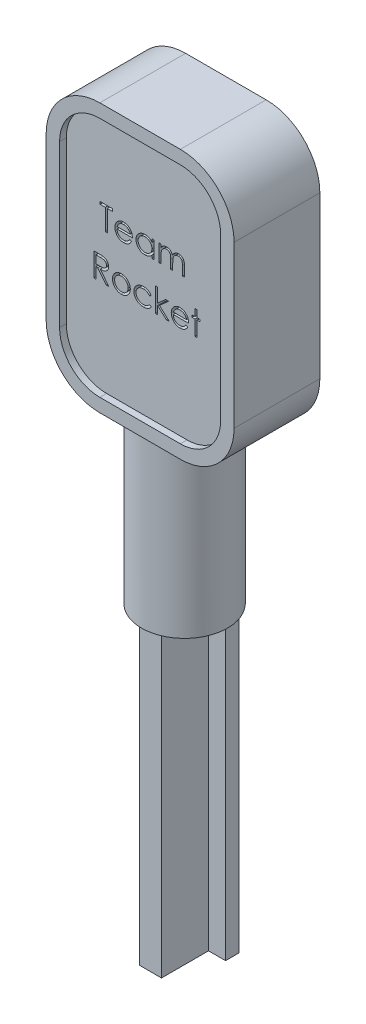
from build123d import *

# Parameters (mm, degrees)
SKETCH7_W           = 8.336373434
SKETCH7_H           = 1.970724418
SKETCH7_W_2         = 3.256066215
SKETCH7_H_2         = 7.004216531
BOSS_EXTRUDE4_DEPTH = 45
SKETCH13_R          = 6.4
BOSS_EXTRUDE7_DEPTH = 25
SKETCH10_W          = 28
SKETCH10_H          = 12.782122078
SKETCH10_R          = 0.037506011
BOSS_EXTRUDE6_DEPTH = 40
FILLET3_R           = 8
FILLET4_R           = 8
FILLET5_R           = 8
FILLET6_R           = 8
CUT_EXTRUDE1_DEPTH  = 1
CUT_EXTRUDE2_START  = -1
CUT_EXTRUDE2_DEPTH  = 1
CUT_EXTRUDE3_DEPTH  = 2


with BuildPart() as part:
    # Sketch7 → Boss-Extrude4 (new body)
    with BuildSketch(Plane(origin=(0, 0, 0), x_dir=(1, 0, 0), z_dir=(0, 1, 0))):
        with Locations((-1.960459031, 3.602750247)):
            Rectangle(SKETCH7_W, SKETCH7_H)
        with Locations((-1.960459031, -0.884720228)):
            Rectangle(SKETCH7_W_2, SKETCH7_H_2)
    extrude(amount=BOSS_EXTRUDE4_DEPTH)

    # Sketch13 → Boss-Extrude7 (add)
    with BuildSketch(Plane(origin=(0, 45, 0), x_dir=(1, 0, 0), z_dir=(0, 1, 0))):
        with Locations(Location((-1.960459031, 0.672633255, 0), (0, 0, 270))):
            Circle(SKETCH13_R)
    extrude(amount=BOSS_EXTRUDE7_DEPTH)

    # Sketch10 → Boss-Extrude6 (add)
    with BuildSketch(Plane(origin=(0, 70, 0), x_dir=(1, 0, 0), z_dir=(0, 1, 0))):
        with Locations((-1.858685537, 0.341682691)):
            Rectangle(SKETCH10_W, SKETCH10_H)
        with Locations(Location((3.255474538, 4.236787445, 0), (0, 0, 270))):
            Circle(SKETCH10_R, mode=Mode.SUBTRACT)
    extrude(amount=BOSS_EXTRUDE6_DEPTH)

    # Fillet3
    # the kernel refuses this fillet: 8 mm, written as the material it takes off along each edge
    with BuildSketch(Plane(origin=(12.141314463, 70, -26.73274373), x_dir=(-1, 0, 0), z_dir=(0, 0, 1))) as fillet3_piece_1_section:
        with BuildLine():
            CenterArc((FILLET3_R, -FILLET3_R), FILLET3_R, 90, 90)
            Line((0, -FILLET3_R), (0, 0))
            Line((0, 0), (FILLET3_R, 0))
        make_face()
    fillet3_piece_1 = extrude(amount=52.782122079, mode=Mode.PRIVATE)
    fillet3_piece_1 = fillet3_piece_1 - Plane(origin=(-1.960459031, 71.811434003, -0.672633255), x_dir=(0, 0, 1), z_dir=(0, -1, 0)) * Cylinder(6.4, 138, mode=Mode.PRIVATE)
    add(fillet3_piece_1, mode=Mode.SUBTRACT)

    # Fillet4
    # the kernel refuses this fillet: 8 mm, written as the material it takes off along each edge
    with BuildSketch(Plane(origin=(-15.858685537, 70, 26.049378348), x_dir=(1, 0, 0), z_dir=(0, 0, -1))) as fillet4_piece_1_section:
        with BuildLine():
            CenterArc((FILLET4_R, -FILLET4_R), FILLET4_R, 90, 90)
            Line((0, -FILLET4_R), (0, 0))
            Line((0, 0), (FILLET4_R, 0))
        make_face()
    fillet4_piece_1 = extrude(amount=52.782122079, mode=Mode.PRIVATE)
    fillet4_piece_1 = fillet4_piece_1 - Plane(origin=(-1.960459031, 71.811762355, -0.672633255), x_dir=(0, 0, 1), z_dir=(0, -1, 0)) * Cylinder(6.4, 138, mode=Mode.PRIVATE)
    add(fillet4_piece_1, mode=Mode.SUBTRACT)

    # Fillet5
    fillet5_edges = [part.edges().sort_by_distance(p)[0] for p in [
        (12.141314463, 110, -0.341682691),
    ]]
    fillet(fillet5_edges, radius=FILLET5_R)

    # Fillet6
    fillet6_edges = [part.edges().sort_by_distance(p)[0] for p in [
        (-15.858685537, 110, -0.341682691),
    ]]
    fillet(fillet6_edges, radius=FILLET6_R)

    # Sketch11 → Cut-Extrude1 (cut)
    with BuildSketch(Plane(origin=(0, 0, -6.73274373), x_dir=(-1, 0, 0), z_dir=(0, 0, -1))):
        with BuildLine():
            Line((4.018385421, 72), (7.858685537, 72))
            ThreePointArc((7.858685537, 72), (12.101326224, 73.757359313), (13.858685537, 78))
            Line((13.858685537, 78), (13.858685537, 102))
            ThreePointArc((13.858685537, 102), (12.101326224, 106.242640687), (7.858685537, 108))
            Line((7.858685537, 108), (-4.141314463, 108))
            ThreePointArc((-4.141314463, 108), (-8.38395515, 106.242640687), (-10.141314463, 102))
            Line((-10.141314463, 102), (-10.141314463, 78))
            ThreePointArc((-10.141314463, 78), (-8.38395515, 73.757359313), (-4.141314463, 72))
            Line((-4.141314463, 72), (-0.09746736, 72))
            Line((-0.09746736, 72), (4.018385421, 72))
        make_face()
    extrude(amount=-CUT_EXTRUDE1_DEPTH, mode=Mode.SUBTRACT)

    # Sketch12 → Cut-Extrude2 (cut)
    with BuildSketch(Plane.XY.offset(6.049378348).offset(CUT_EXTRUDE2_START)):
        with BuildLine():
            Line((4.141314463, 108), (-7.858685537, 108))
            ThreePointArc((-7.858685537, 108), (-12.101326224, 106.242640687), (-13.858685537, 102))
            Line((-13.858685537, 102), (-13.858685537, 78))
            ThreePointArc((-13.858685537, 78), (-12.101326224, 73.757359313), (-7.858685537, 72))
            Line((-7.858685537, 72), (4.141314463, 72))
            ThreePointArc((4.141314463, 72), (8.38395515, 73.757359313), (10.141314463, 78))
            Line((10.141314463, 78), (10.141314463, 102))
            ThreePointArc((10.141314463, 102), (8.38395515, 106.242640687), (4.141314463, 108))
        make_face()
    extrude(amount=CUT_EXTRUDE2_DEPTH, mode=Mode.SUBTRACT)

    # Sketch14 → Cut-Extrude3 (cut)
    # profile 1 of 10: a face of its own
    with BuildSketch(Plane.XY.offset(5.049378348)):
        Polygon((-8.80905258, 95.927677852), (-8.80905258, 96.286652211), (-6.96930899, 96.286652211), (-6.96930899, 95.927677852), (-7.732129503, 95.927677852), (-7.732129503, 92.786652211), (-8.046232067, 92.786652211), (-8.046232067, 95.927677852), align=None)
    # profile 2 of 10: a face of its own
    with BuildSketch(Plane.XY.offset(5.049378348)):
        with BuildLine():
            Line((-4.421432387, 93.594344519), (-4.142385913, 93.447810063))
            add(Edge.make_bspline(
                [(-4.142385913, 93.447810063), (-4.164622508, 93.408366732), (-4.207886117, 93.331625629), (-4.282286864, 93.226193769), (-4.360278937, 93.131346053), (-4.445382905, 93.049616399), (-4.535052584, 92.978365014), (-4.629785239, 92.916027189), (-4.730074057, 92.862908669), (-4.835923781, 92.818156141), (-4.948223332, 92.783746647), (-5.067244849, 92.759442426), (-5.193216344, 92.744419157), (-5.279562524, 92.742674016), (-5.323776137, 92.741780416)],
                knots=[0, 0, 0, 0, 1.120438281, 2.179929193, 3.190490725, 4.156257408, 5.095198341, 6.022838206, 6.959905092, 7.901321166, 8.864066838, 9.862729781, 10.905609505, 12, 12, 12, 12], degree=3))
            add(Edge.make_bspline(
                [(-5.323776137, 92.741780416), (-5.372918115, 92.742927591), (-5.468779876, 92.745165398), (-5.608319624, 92.764457862), (-5.739699042, 92.795930221), (-5.862910745, 92.839895763), (-5.977652998, 92.897323087), (-6.084153853, 92.967282569), (-6.182973379, 93.049414823), (-6.270997588, 93.144431267), (-6.35024147, 93.246113224), (-6.42016729, 93.352069109), (-6.478624721, 93.462032333), (-6.526177332, 93.575302857), (-6.564582197, 93.691166751), (-6.5913489, 93.810678218), (-6.606778648, 93.933513802), (-6.609143094, 94.016611138), (-6.610334631, 94.058487147)],
                knots=[0, 0, 0, 0, 1.145258523, 2.234067595, 3.276747158, 4.290159414, 5.277019952, 6.260822364, 7.254936242, 8.264827045, 9.274100331, 10.257902744, 11.220704747, 12.172965371, 13.118907548, 14.062713208, 15.023725156, 16, 16, 16, 16], degree=3))
            add(Edge.make_bspline(
                [(-6.610334631, 94.058487147), (-6.609275489, 94.097781977), (-6.607176411, 94.175659142), (-6.593945624, 94.290924686), (-6.570497331, 94.402953139), (-6.538321007, 94.511837587), (-6.496769761, 94.617395721), (-6.445937541, 94.719691785), (-6.385745164, 94.818616924), (-6.33927249, 94.881020058), (-6.315863477, 94.912453493)],
                knots=[0, 0, 0, 0, 1.024358464, 2.0301432, 3.019427413, 4.004406732, 4.986367066, 5.972626655, 6.978780325, 8, 8, 8, 8], degree=3))
            add(Edge.make_bspline(
                [(-6.315863477, 94.912453493), (-6.284155794, 94.950322363), (-6.221744848, 95.024860513), (-6.116188492, 95.122798839), (-6.001888296, 95.204842614), (-5.88027667, 95.272849751), (-5.749940196, 95.324523398), (-5.612630905, 95.36303098), (-5.466785318, 95.384608991), (-5.367080098, 95.387656824), (-5.316063797, 95.389216313)],
                knots=[0, 0, 0, 0, 1.030682036, 2.02871468, 2.997146059, 3.962720338, 4.930598197, 5.918074684, 6.934738563, 8, 8, 8, 8], degree=3))
            add(Edge.make_bspline(
                [(-5.316063797, 95.389216313), (-5.263616192, 95.387862265), (-5.160725946, 95.385205929), (-5.010693825, 95.360579596), (-4.868733109, 95.321527041), (-4.734900604, 95.266373251), (-4.609182744, 95.195213699), (-4.492396694, 95.107071858), (-4.382545181, 95.00465377), (-4.318636603, 94.925890561), (-4.286115881, 94.885810865)],
                knots=[0, 0, 0, 0, 1.056321875, 2.072262726, 3.055038591, 4.01806755, 4.982017516, 5.957941055, 6.960871419, 8, 8, 8, 8], degree=3))
            add(Edge.make_bspline(
                [(-4.286115881, 94.885810865), (-4.263988943, 94.855607283), (-4.219882349, 94.795401165), (-4.164635249, 94.697230008), (-4.116677854, 94.594519413), (-4.078344893, 94.485609116), (-4.047305392, 94.371789536), (-4.024848573, 94.252246991), (-4.011678955, 94.12701708), (-4.009090258, 94.041690524), (-4.007770528, 93.998190672)],
                knots=[0, 0, 0, 0, 0.94817472, 1.890038105, 2.849395472, 3.817997239, 4.812318967, 5.836947057, 6.897266129, 8, 8, 8, 8], degree=3))
            Line((-4.007770528, 93.998190672), (-6.296232067, 93.998190672))
            add(Edge.make_bspline(
                [(-6.296232067, 93.998190672), (-6.29469246, 93.964490208), (-6.291664886, 93.898219604), (-6.277549743, 93.801248821), (-6.255300969, 93.708875479), (-6.224031907, 93.621792437), (-6.186165062, 93.53886231), (-6.139779345, 93.460700273), (-6.084439791, 93.387662343), (-6.022714091, 93.319095205), (-5.954006996, 93.258034444), (-5.881724249, 93.203382668), (-5.804830684, 93.157577071), (-5.7239326, 93.120397181), (-5.639160815, 93.091290865), (-5.55048862, 93.071423044), (-5.458090504, 93.058115938), (-5.39510477, 93.056636272), (-5.363038958, 93.05588298)],
                knots=[0, 0, 0, 0, 1.094153842, 2.151609401, 3.174256925, 4.172055639, 5.149267565, 6.128595816, 7.11444997, 8.118368179, 9.117203808, 10.09244225, 11.054858984, 12.015122123, 12.976791628, 13.957293641, 14.960065497, 16, 16, 16, 16], degree=3))
            add(Edge.make_bspline(
                [(-5.363038958, 93.05588298), (-5.33168781, 93.056491037), (-5.269481119, 93.057697538), (-5.176840262, 93.069429449), (-5.085700734, 93.088399724), (-4.996439751, 93.114289714), (-4.910868905, 93.145866567), (-4.831623355, 93.183969424), (-4.75874314, 93.226119171), (-4.690626173, 93.274328846), (-4.62455518, 93.333337033), (-4.559012693, 93.406972754), (-4.48873604, 93.494060282), (-4.444746447, 93.559605948), (-4.421432387, 93.594344519)],
                knots=[0, 0, 0, 0, 0.99110716, 1.966546729, 2.947904876, 3.932708344, 4.903319531, 5.828989031, 6.710028674, 7.56322171, 8.463672341, 9.504779593, 10.677557249, 12, 12, 12, 12], degree=3))
        make_face()
        with BuildLine():
            add(Edge.make_bspline(
                [(-4.321873092, 94.312293237), (-4.333369717, 94.35395611), (-4.355497018, 94.434143731), (-4.401733383, 94.545184621), (-4.453804924, 94.643872522), (-4.515426655, 94.729452155), (-4.585245381, 94.805455668), (-4.665890563, 94.871874253), (-4.756326457, 94.931291705), (-4.856085597, 94.981444204), (-4.961727382, 95.024134063), (-5.072333574, 95.052759178), (-5.185191362, 95.072368721), (-5.261525649, 95.074194829), (-5.299937996, 95.075113749)],
                knots=[0, 0, 0, 0, 1.154881502, 2.222775134, 3.210006277, 4.132804581, 5.035138423, 5.962687519, 6.919655026, 7.923214229, 8.944639381, 9.960483929, 10.97369054, 12, 12, 12, 12], degree=3))
            add(Edge.make_bspline(
                [(-5.299937996, 95.075113749), (-5.331287435, 95.074502078), (-5.393258684, 95.073292932), (-5.484559752, 95.061822802), (-5.572239451, 95.042862958), (-5.656944738, 95.016898001), (-5.737565607, 94.982289398), (-5.815760375, 94.941706172), (-5.889540771, 94.892164588), (-5.935682067, 94.854405733), (-5.958992483, 94.835330095)],
                knots=[0, 0, 0, 0, 1.04873581, 2.073130211, 3.073294108, 4.04793562, 5.032784715, 6.005352987, 6.992311501, 8, 8, 8, 8], degree=3))
            add(Edge.make_bspline(
                [(-5.958992483, 94.835330095), (-5.975685765, 94.82023578), (-6.0094689, 94.789688564), (-6.054609421, 94.737059357), (-6.097829894, 94.680307795), (-6.137163547, 94.617262671), (-6.173241133, 94.548641891), (-6.20700111, 94.475024256), (-6.237387522, 94.395851126), (-6.254483632, 94.340678687), (-6.263279342, 94.312293237)],
                knots=[0, 0, 0, 0, 0.879870761, 1.780643979, 2.707998968, 3.669668524, 4.684282772, 5.740141944, 6.837334558, 8, 8, 8, 8], degree=3))
            Line((-6.263279342, 94.312293237), (-4.321873092, 94.312293237))
        make_face(mode=Mode.SUBTRACT)
    # profile 3 of 10: a face of its own
    with BuildSketch(Plane.XY.offset(5.049378348)):
        with BuildLine():
            Line((-0.777001297, 95.344344519), (-0.777001297, 92.786652211))
            Line((-0.777001297, 92.786652211), (-1.091103862, 92.786652211))
            Line((-1.091103862, 92.786652211), (-1.091103862, 93.229060063))
            add(Edge.make_bspline(
                [(-1.091103862, 93.229060063), (-1.126522652, 93.189020469), (-1.195642867, 93.110882698), (-1.311083985, 93.008800526), (-1.433452163, 92.924422204), (-1.562153485, 92.856272289), (-1.697071728, 92.805080232), (-1.837907815, 92.768694073), (-1.984719196, 92.745300238), (-2.084971551, 92.742964216), (-2.135775336, 92.741780416)],
                knots=[0, 0, 0, 0, 1.074387032, 2.096679803, 3.090159297, 4.057316773, 5.018401886, 5.985159533, 6.978961417, 8, 8, 8, 8], degree=3))
            add(Edge.make_bspline(
                [(-2.135775336, 92.741780416), (-2.18094329, 92.743006788), (-2.270016495, 92.745425249), (-2.401045572, 92.764187552), (-2.527137821, 92.794318174), (-2.648412394, 92.836219063), (-2.764084539, 92.891799885), (-2.875144636, 92.958341133), (-2.981017328, 93.037581963), (-3.080088867, 93.128169992), (-3.171320867, 93.226564979), (-3.25138214, 93.331510526), (-3.31813522, 93.44255283), (-3.373955301, 93.558285983), (-3.416951645, 93.679600903), (-3.446925279, 93.806078071), (-3.465665726, 93.937567944), (-3.468083187, 94.027107468), (-3.46930899, 94.072509583)],
                knots=[0, 0, 0, 0, 1.033919861, 2.038935746, 3.024066025, 3.998881131, 4.97069526, 5.957263378, 6.95902576, 7.993208707, 9.027059324, 10.027763471, 11.009749337, 11.988697705, 12.965288445, 13.950418724, 14.960734635, 16, 16, 16, 16], degree=3))
            add(Edge.make_bspline(
                [(-3.46930899, 94.072509583), (-3.468056018, 94.116973286), (-3.465578962, 94.20487563), (-3.447125742, 94.334154328), (-3.416094733, 94.458672588), (-3.372546885, 94.578029532), (-3.31670493, 94.692369582), (-3.248776843, 94.801773607), (-3.168757719, 94.906543004), (-3.076505312, 95.004214231), (-2.976570542, 95.094434845), (-2.869661811, 95.172843891), (-2.758438529, 95.240560739), (-2.641175519, 95.294214216), (-2.519608414, 95.33762332), (-2.392654968, 95.367656288), (-2.26084339, 95.38535361), (-2.171352897, 95.387916374), (-2.125959631, 95.389216313)],
                knots=[0, 0, 0, 0, 1.020392517, 2.01726096, 2.990465484, 3.961182959, 4.928053699, 5.906110375, 6.912531644, 7.948652711, 8.985773172, 9.998621852, 10.987621588, 11.969261332, 12.953316658, 13.946091881, 14.958173133, 16, 16, 16, 16], degree=3))
            add(Edge.make_bspline(
                [(-2.125959631, 95.389216313), (-2.073759772, 95.387778562), (-1.971398312, 95.384959199), (-1.821670303, 95.361496472), (-1.680025825, 95.321858005), (-1.545371473, 95.267940506), (-1.418190786, 95.196291777), (-1.299687802, 95.105911816), (-1.188622319, 94.997370629), (-1.124242027, 94.914000185), (-1.091103862, 94.871087307)],
                knots=[0, 0, 0, 0, 1.038897134, 2.037228247, 3.008116434, 3.962042015, 4.918381754, 5.904844433, 6.921570401, 8, 8, 8, 8], degree=3))
            Line((-1.091103862, 94.871087307), (-1.091103862, 95.344344519))
            Line((-1.091103862, 95.344344519), (-0.777001297, 95.344344519))
        make_face()
        with BuildLine():
            add(Edge.make_bspline(
                [(-2.1217529, 95.075113749), (-2.167667238, 95.073480112), (-2.258294838, 95.070255571), (-2.39133884, 95.045082075), (-2.518652254, 95.003197481), (-2.639598328, 94.94591558), (-2.752266545, 94.873886843), (-2.852960216, 94.78676546), (-2.942502917, 94.686928446), (-3.017811181, 94.574826335), (-3.079201678, 94.454648244), (-3.12236871, 94.329023806), (-3.150837958, 94.200218829), (-3.153746478, 94.112856143), (-3.155206426, 94.069003974)],
                knots=[0, 0, 0, 0, 1.031046209, 2.035121221, 3.029706178, 4.034933723, 5.034054252, 6.02443088, 7.017295772, 8.038157696, 9.050218397, 10.03989886, 11.016116709, 12, 12, 12, 12], degree=3))
            add(Edge.make_bspline(
                [(-3.155206426, 94.069003974), (-3.153341532, 94.025413867), (-3.149619056, 93.938404511), (-3.122868361, 93.809423934), (-3.077988488, 93.683769892), (-3.016746425, 93.562508898), (-2.9400598, 93.449924798), (-2.851171148, 93.348184675), (-2.749220866, 93.260695087), (-2.636293359, 93.187457513), (-2.515685389, 93.128294993), (-2.388851457, 93.087129353), (-2.258175819, 93.060551572), (-2.169323485, 93.057447096), (-2.124557387, 93.05588298)],
                knots=[0, 0, 0, 0, 0.979072187, 1.954306742, 2.945804271, 3.96968567, 4.997920485, 5.998718438, 6.996577872, 8.005894225, 9.015743152, 10.005417472, 10.995077863, 12, 12, 12, 12], degree=3))
            add(Edge.make_bspline(
                [(-2.124557387, 93.05588298), (-2.079110884, 93.057542944), (-1.988722298, 93.060844448), (-1.85528359, 93.086125713), (-1.725788627, 93.127894511), (-1.602001399, 93.185793638), (-1.486685268, 93.257550994), (-1.38318739, 93.341558085), (-1.295671422, 93.439261269), (-1.221478812, 93.546637722), (-1.163303395, 93.664349719), (-1.120927336, 93.789683909), (-1.095873431, 93.922644657), (-1.092715701, 94.013508584), (-1.091103862, 94.05988939)],
                knots=[0, 0, 0, 0, 1.01762866, 2.023962475, 3.030623092, 4.058876274, 5.077231937, 6.066672613, 7.034107872, 8.005628644, 8.981990164, 9.965428785, 10.961468474, 12, 12, 12, 12], degree=3))
            add(Edge.make_bspline(
                [(-1.091103862, 94.05988939), (-1.092063518, 94.095227221), (-1.093952425, 94.164783254), (-1.108382995, 94.266910772), (-1.131337921, 94.364644498), (-1.163684091, 94.458087187), (-1.206175376, 94.546722202), (-1.257423142, 94.631185962), (-1.318328591, 94.711039174), (-1.387911287, 94.785182245), (-1.46407649, 94.852808707), (-1.544671031, 94.913172948), (-1.630649778, 94.962761721), (-1.720566815, 95.003802992), (-1.814578149, 95.036462142), (-1.913448769, 95.058249836), (-2.016127756, 95.073210157), (-2.086173811, 95.074472538), (-2.1217529, 95.075113749)],
                knots=[0, 0, 0, 0, 1.050140795, 2.067009409, 3.05949893, 4.030605086, 5.00011959, 5.97591094, 6.962425594, 7.979863591, 8.993523472, 9.986985069, 10.967611495, 11.937549037, 12.921786183, 13.919465291, 14.943216303, 16, 16, 16, 16], degree=3))
        make_face(mode=Mode.SUBTRACT)
    # profile 4 of 10: a face of its own
    with BuildSketch(Plane.XY.offset(5.049378348)):
        with BuildLine():
            Line((-0.05905258, 95.344344519), (0.255049985, 95.344344519))
            Line((0.255049985, 95.344344519), (0.255049985, 94.899833301))
            add(Edge.make_bspline(
                [(0.255049985, 94.899833301), (0.283333934, 94.938720902), (0.337528694, 95.013233275), (0.426394347, 95.11142356), (0.515170459, 95.194751714), (0.579103841, 95.238494586), (0.609817613, 95.259508781)],
                knots=[0, 0, 0, 0, 1.134379233, 2.173579362, 3.122582517, 4, 4, 4, 4], degree=3))
            add(Edge.make_bspline(
                [(0.609817613, 95.259508781), (0.651682275, 95.279514147), (0.734680175, 95.31917536), (0.8660994, 95.359408919), (1.000574069, 95.38413402), (1.091382283, 95.387515394), (1.137061203, 95.389216313)],
                knots=[0, 0, 0, 0, 1.014936303, 2.012140481, 3.000054389, 4, 4, 4, 4], degree=3))
            add(Edge.make_bspline(
                [(1.137061203, 95.389216313), (1.167954199, 95.388171023), (1.229089778, 95.386102448), (1.319673868, 95.372642413), (1.40753248, 95.34937624), (1.492146509, 95.316968916), (1.571867189, 95.277722229), (1.644956386, 95.231672521), (1.710580595, 95.179975446), (1.768706646, 95.120296513), (1.820975671, 95.050959915), (1.869054518, 94.970095666), (1.91347973, 94.875888005), (1.938101039, 94.807521464), (1.951063606, 94.771528012)],
                knots=[0, 0, 0, 0, 1.009824226, 1.998387844, 2.986035974, 3.974953746, 4.955485308, 5.885931332, 6.793869504, 7.679848016, 8.601185859, 9.625726857, 10.749998409, 12, 12, 12, 12], degree=3))
            add(Edge.make_bspline(
                [(1.951063606, 94.771528012), (1.964774858, 94.796252431), (1.991756675, 94.844906616), (2.037062312, 94.913764879), (2.084530108, 94.97817167), (2.134564601, 95.038178095), (2.186989188, 95.093487825), (2.242050589, 95.144283727), (2.29943537, 95.190783941), (2.37922761, 95.2451071), (2.483040217, 95.302808281), (2.613928332, 95.352836725), (2.750078504, 95.383752854), (2.842496202, 95.387383127), (2.889164568, 95.389216313)],
                knots=[0, 0, 0, 0, 0.86119277, 1.694706429, 2.50939023, 3.298075842, 4.073795165, 4.829715201, 5.57930267, 6.321991688, 7.768977793, 9.186738141, 10.579381044, 12, 12, 12, 12], degree=3))
            add(Edge.make_bspline(
                [(2.889164568, 95.389216313), (2.932046031, 95.387599093), (3.015969217, 95.384434034), (3.138146483, 95.359580561), (3.252088288, 95.316902914), (3.357565364, 95.258669277), (3.452725178, 95.185490094), (3.535441487, 95.098421256), (3.60521185, 94.998078633), (3.65079049, 94.903686645), (3.681705754, 94.820351312), (3.700766988, 94.749345021), (3.717606683, 94.671193468), (3.731587929, 94.585803206), (3.741806481, 94.492872598), (3.749377196, 94.392553722), (3.75450127, 94.28476861), (3.754863342, 94.21040311), (3.755049985, 94.172068878)],
                knots=[0, 0, 0, 0, 1.209669288, 2.367440248, 3.500751976, 4.631527125, 5.755587489, 6.87532382, 8.007944318, 9.190864318, 9.82315674, 10.514484317, 11.263564316, 12.079023757, 12.955305781, 13.901327259, 14.918167583, 16, 16, 16, 16], degree=3))
            Line((3.755049985, 94.172068878), (3.755049985, 92.786652211))
            Line((3.755049985, 92.786652211), (3.44094742, 92.786652211))
            Line((3.44094742, 92.786652211), (3.44094742, 94.173471121))
            add(Edge.make_bspline(
                [(3.44094742, 94.173471121), (3.440869537, 94.206191695), (3.440719858, 94.269075662), (3.438026227, 94.359328113), (3.432950913, 94.44159647), (3.427016274, 94.515768559), (3.418772464, 94.582017347), (3.408126533, 94.640209766), (3.396848853, 94.690803577), (3.378112862, 94.746889625), (3.34816497, 94.808759835), (3.30254749, 94.875483411), (3.245077384, 94.933564211), (3.178717227, 94.983982528), (3.103168783, 95.024976169), (3.019904059, 95.054252179), (2.929440008, 95.072375057), (2.866817219, 95.074181073), (2.834477068, 95.075113749)],
                knots=[0, 0, 0, 0, 1.253487763, 2.409012846, 3.458416907, 4.410876679, 5.259312806, 6.014470957, 6.676830364, 7.243083969, 8.276244668, 9.299465089, 10.325150304, 11.392391894, 12.482080715, 13.603491619, 14.762376348, 16, 16, 16, 16], degree=3))
            add(Edge.make_bspline(
                [(2.834477068, 95.075113749), (2.794807114, 95.073697592), (2.716404202, 95.070898727), (2.601958716, 95.042324854), (2.4919877, 94.999244603), (2.389772567, 94.936812146), (2.295744776, 94.862003782), (2.214845198, 94.773054186), (2.148013013, 94.672424259), (2.102759037, 94.579277557), (2.074169735, 94.495608113), (2.05529282, 94.422510741), (2.040609428, 94.339429173), (2.026838899, 94.246921682), (2.017851171, 94.144351502), (2.009682799, 94.032193101), (2.005861936, 93.910109142), (2.005327477, 93.825482453), (2.005049985, 93.781544038)],
                knots=[0, 0, 0, 0, 1.090531906, 2.155305635, 3.229839962, 4.33261226, 5.44038871, 6.529323825, 7.629011124, 8.757537029, 9.370236727, 10.061839251, 10.834451254, 11.692844982, 12.636905849, 13.66920014, 14.789842145, 16, 16, 16, 16], degree=3))
            Line((2.005049985, 93.781544038), (2.005049985, 92.786652211))
            Line((2.005049985, 92.786652211), (1.69094742, 92.786652211))
            Line((1.69094742, 92.786652211), (1.69094742, 94.08723314))
            add(Edge.make_bspline(
                [(1.69094742, 94.08723314), (1.690867989, 94.123926459), (1.690715172, 94.194520716), (1.688038855, 94.295754392), (1.682952233, 94.387835472), (1.677071685, 94.470656936), (1.668611506, 94.544068264), (1.659001744, 94.608463022), (1.647653134, 94.663679773), (1.628863249, 94.724243158), (1.600148781, 94.790964081), (1.553960519, 94.862105102), (1.496352938, 94.9243732), (1.428782063, 94.977531948), (1.35277638, 95.02147343), (1.26879298, 95.053133181), (1.177588067, 95.071557471), (1.114710361, 95.073905968), (1.082373703, 95.075113749)],
                knots=[0, 0, 0, 0, 1.320475261, 2.540461679, 3.643808994, 4.639130445, 5.527981419, 6.302341397, 6.981980563, 7.553956391, 8.582137848, 9.585246428, 10.591171744, 11.620968678, 12.668337649, 13.738356861, 14.836885341, 16, 16, 16, 16], degree=3))
            add(Edge.make_bspline(
                [(1.082373703, 95.075113749), (1.044357491, 95.073583289), (0.968592532, 95.070533137), (0.857290562, 95.043078863), (0.749804878, 95.000074788), (0.64785018, 94.940414969), (0.554176031, 94.866515891), (0.472167764, 94.779600995), (0.403225238, 94.680751961), (0.357493424, 94.588587445), (0.327994949, 94.50701417), (0.308399615, 94.437663222), (0.291559989, 94.360662974), (0.279045967, 94.275775863), (0.266965552, 94.183554769), (0.261135243, 94.083540279), (0.25546368, 93.975818191), (0.255191266, 93.901445646), (0.255049985, 93.862874166)],
                knots=[0, 0, 0, 0, 1.098833095, 2.189935336, 3.297829714, 4.440610912, 5.596351641, 6.740013378, 7.886572111, 9.072425424, 9.705826452, 10.395263256, 11.156850408, 11.985370555, 12.878090359, 13.847760091, 14.883794034, 16, 16, 16, 16], degree=3))
            Line((0.255049985, 93.862874166), (0.255049985, 92.786652211))
            Line((0.255049985, 92.786652211), (-0.05905258, 92.786652211))
            Line((-0.05905258, 92.786652211), (-0.05905258, 95.344344519))
        make_face()
    # profile 5 of 10: a face of its own
    with BuildSketch(Plane.XY.offset(5.049378348)):
        with BuildLine():
            Line((-9.751360272, 89.453318878), (-9.050939599, 89.453318878))
            add(Edge.make_bspline(
                [(-9.050939599, 89.453318878), (-9.00419847, 89.453163292), (-8.914450326, 89.452864549), (-8.785877055, 89.451198786), (-8.669049958, 89.446424431), (-8.564030119, 89.442315847), (-8.470819464, 89.434823906), (-8.389132173, 89.427663259), (-8.319344476, 89.418289598), (-8.277098625, 89.409584175), (-8.257970849, 89.405642595)],
                knots=[0, 0, 0, 0, 1.410062039, 2.707475311, 3.878576406, 4.937260626, 5.877586885, 6.699081471, 7.410979367, 8, 8, 8, 8], degree=3))
            add(Edge.make_bspline(
                [(-8.257970849, 89.405642595), (-8.232364225, 89.39931583), (-8.181697235, 89.386797266), (-8.108747169, 89.360337666), (-8.039232845, 89.329718041), (-7.973443021, 89.293754321), (-7.91170723, 89.252179541), (-7.853388919, 89.205711419), (-7.798223455, 89.154604213), (-7.748441825, 89.097569371), (-7.701502774, 89.037732862), (-7.661914147, 88.973029105), (-7.627787667, 88.905367577), (-7.60061715, 88.83406016), (-7.578739177, 88.759798388), (-7.563312938, 88.681909591), (-7.55406175, 88.600748616), (-7.553119894, 88.545390707), (-7.552642323, 88.517321281)],
                knots=[0, 0, 0, 0, 1.027469482, 2.033020251, 3.019912614, 3.986113645, 4.951240523, 5.91722682, 6.890402269, 7.87763091, 8.8651537, 9.85103654, 10.82876324, 11.815024772, 12.821070561, 13.842952187, 14.906261191, 16, 16, 16, 16], degree=3))
            add(Edge.make_bspline(
                [(-7.552642323, 88.517321281), (-7.554111321, 88.470686177), (-7.556977717, 88.379689009), (-7.583702821, 88.247628127), (-7.62747934, 88.124438813), (-7.687802629, 88.010276175), (-7.764622105, 87.90736553), (-7.856946896, 87.816975074), (-7.964828508, 87.741335162), (-8.065257824, 87.688882357), (-8.153972023, 87.655289448), (-8.227005336, 87.631653089), (-8.306672314, 87.613391124), (-8.392209648, 87.597030992), (-8.483973304, 87.584679298), (-8.581743343, 87.575632704), (-8.685589495, 87.569978655), (-8.756928564, 87.56913665), (-8.7936279, 87.568703493)],
                knots=[0, 0, 0, 0, 1.260483769, 2.459530307, 3.627416485, 4.787058657, 5.939039949, 7.08810263, 8.267026773, 9.491475466, 10.141966685, 10.831826277, 11.566392101, 12.351337768, 13.187381173, 14.07005841, 15.007169909, 16, 16, 16, 16], degree=3))
            Line((-8.7936279, 87.568703493), (-7.507770528, 85.953318878))
            Line((-7.507770528, 85.953318878), (-7.896192003, 85.953318878))
            Line((-7.896192003, 85.953318878), (-9.182049374, 87.568703493))
            Line((-9.182049374, 87.568703493), (-9.437257708, 87.568703493))
            Line((-9.437257708, 87.568703493), (-9.437257708, 85.953318878))
            Line((-9.437257708, 85.953318878), (-9.751360272, 85.953318878))
            Line((-9.751360272, 85.953318878), (-9.751360272, 89.453318878))
        make_face()
        with BuildLine():
            Line((-9.437257708, 89.094344519), (-9.437257708, 87.927677852))
            Line((-9.437257708, 87.927677852), (-8.796432387, 87.922769999))
            add(Edge.make_bspline(
                [(-8.796432387, 87.922769999), (-8.766512348, 87.922756763), (-8.708518791, 87.922731106), (-8.624618126, 87.926724883), (-8.546498015, 87.931268201), (-8.474457263, 87.938217546), (-8.408463687, 87.947173618), (-8.348550274, 87.958376602), (-8.294619222, 87.971428665), (-8.231720684, 87.991630291), (-8.161484152, 88.023636309), (-8.085152692, 88.070201808), (-8.020150355, 88.128770927), (-7.965232492, 88.195744383), (-7.921103061, 88.269380632), (-7.889991007, 88.348797001), (-7.870248564, 88.431988599), (-7.867920019, 88.489166707), (-7.866744887, 88.518022403)],
                knots=[0, 0, 0, 0, 1.146690395, 2.22261258, 3.21895312, 4.145990853, 4.996080663, 5.770904154, 6.481378293, 7.121626537, 8.300444488, 9.431385265, 10.535395872, 11.636531494, 12.74115979, 13.810798291, 14.895190096, 16, 16, 16, 16], degree=3))
            add(Edge.make_bspline(
                [(-7.866744887, 88.518022403), (-7.867947008, 88.546168977), (-7.870329174, 88.601945216), (-7.889777942, 88.683601126), (-7.922667324, 88.760668076), (-7.966989561, 88.832832561), (-8.020988716, 88.898338297), (-8.084306529, 88.95438545), (-8.155211724, 89.000634915), (-8.221482923, 89.030189295), (-8.280717135, 89.048309148), (-8.332146795, 89.061060312), (-8.390258273, 89.071304781), (-8.455333732, 89.079512842), (-8.527095362, 89.086567786), (-8.605906013, 89.091319565), (-8.691242794, 89.094133429), (-8.750389725, 89.094272518), (-8.781007708, 89.094344519)],
                knots=[0, 0, 0, 0, 1.101028733, 2.181837193, 3.264309656, 4.369019818, 5.486613113, 6.575447106, 7.666700264, 8.788928104, 9.402425223, 10.0903467, 10.862060571, 11.710948788, 12.657782767, 13.684531032, 14.801375019, 16, 16, 16, 16], degree=3))
            Line((-8.781007708, 89.094344519), (-9.437257708, 89.094344519))
        make_face(mode=Mode.SUBTRACT)
    # profile 6 of 10: a face of its own
    with BuildSketch(Plane.XY.offset(5.049378348)):
        with BuildLine():
            add(Edge.make_bspline(
                [(-5.644188797, 88.55588298), (-5.596197525, 88.554861089), (-5.502098367, 88.55285741), (-5.364290481, 88.531442445), (-5.232745345, 88.49869508), (-5.106959153, 88.453423518), (-4.988542858, 88.392741568), (-4.875771614, 88.320332276), (-4.768954605, 88.234549683), (-4.704931575, 88.168191614), (-4.67243399, 88.134508781)],
                knots=[0, 0, 0, 0, 1.054011418, 2.066658804, 3.057071809, 4.030435133, 4.997543892, 5.974964718, 6.972108034, 8, 8, 8, 8], degree=3))
            add(Edge.make_bspline(
                [(-4.67243399, 88.134508781), (-4.644452036, 88.102294796), (-4.589029655, 88.038490253), (-4.517963937, 87.93503464), (-4.456742377, 87.82789454), (-4.407679416, 87.715647213), (-4.368994392, 87.599272542), (-4.341528696, 87.478370531), (-4.325191761, 87.353208184), (-4.322988794, 87.268204346), (-4.321873092, 87.225153813)],
                knots=[0, 0, 0, 0, 1.025258237, 2.030674902, 3.01204498, 3.988269485, 4.97094183, 5.956517959, 6.965070386, 8, 8, 8, 8], degree=3))
            add(Edge.make_bspline(
                [(-4.321873092, 87.225153813), (-4.32285443, 87.181853756), (-4.324793598, 87.096290822), (-4.343137214, 86.970271457), (-4.3716683, 86.848076634), (-4.412500138, 86.73021794), (-4.464858248, 86.616335113), (-4.528748935, 86.506925564), (-4.604620552, 86.40177343), (-4.690624549, 86.301771592), (-4.785676425, 86.209605377), (-4.888792574, 86.129277108), (-4.997946607, 86.060455583), (-5.114589961, 86.005019168), (-5.237657447, 85.961309467), (-5.367414516, 85.930609451), (-5.503659586, 85.912047767), (-5.596686807, 85.909664194), (-5.644188797, 85.908447083)],
                knots=[0, 0, 0, 0, 0.998656419, 1.973391657, 2.932242238, 3.890759089, 4.846373663, 5.82037756, 6.809684879, 7.83454468, 8.860553229, 9.859544525, 10.845671541, 11.83227036, 12.833544569, 13.85385346, 14.904124723, 16, 16, 16, 16], degree=3))
            add(Edge.make_bspline(
                [(-5.644188797, 85.908447083), (-5.691923517, 85.909668279), (-5.785414377, 85.912060053), (-5.922140359, 85.930537336), (-6.052129978, 85.961295319), (-6.175358576, 86.005162811), (-6.292503423, 86.060457355), (-6.40228992, 86.129069045), (-6.505489836, 86.2096292), (-6.60056182, 86.301765137), (-6.686560425, 86.401775093), (-6.762433434, 86.506925132), (-6.82632376, 86.616335225), (-6.878681964, 86.73021791), (-6.919513777, 86.848076642), (-6.948044869, 86.970271454), (-6.966388484, 87.096290823), (-6.968327652, 87.181853756), (-6.96930899, 87.225153813)],
                knots=[0, 0, 0, 0, 1.099876186, 2.154163076, 3.173186993, 4.173200201, 5.163417411, 6.152872554, 7.150605724, 8.17532212, 9.198891216, 10.186952605, 11.159729845, 12.11414092, 13.071450619, 14.029093627, 15.002601286, 16, 16, 16, 16], degree=3))
            add(Edge.make_bspline(
                [(-6.96930899, 87.225153813), (-6.968185679, 87.267970359), (-6.965961718, 87.352739762), (-6.949641209, 87.477666822), (-6.922282652, 87.598364211), (-6.883551256, 87.714289687), (-6.834036065, 87.826045123), (-6.773674777, 87.933449954), (-6.701884145, 88.036437755), (-6.646682193, 88.100159835), (-6.618748092, 88.132405416)],
                knots=[0, 0, 0, 0, 1.031353054, 2.041901799, 3.029428768, 4.008703097, 4.981709435, 5.96992636, 6.972712378, 8, 8, 8, 8], degree=3))
            add(Edge.make_bspline(
                [(-6.618748092, 88.132405416), (-6.586299501, 88.166380355), (-6.522483637, 88.233198051), (-6.41513491, 88.318730576), (-6.302641089, 88.392646649), (-6.182916163, 88.452122865), (-6.057233305, 88.498961383), (-5.925014062, 88.531526898), (-5.786738547, 88.552780253), (-5.692178925, 88.55483843), (-5.644188797, 88.55588298)],
                knots=[0, 0, 0, 0, 1.027980169, 2.021703884, 2.998553061, 3.971491411, 4.943284454, 5.930300938, 6.949603206, 8, 8, 8, 8], degree=3))
        make_face()
        with BuildLine():
            add(Edge.make_bspline(
                [(-5.645591041, 88.241780416), (-5.679528652, 88.240815824), (-5.746527781, 88.238911542), (-5.845147366, 88.224427637), (-5.94008752, 88.201480133), (-6.031528364, 88.168876077), (-6.119161536, 88.126777178), (-6.203070939, 88.075068818), (-6.283503379, 88.014435861), (-6.358885442, 87.94497319), (-6.428067754, 87.869094195), (-6.488545731, 87.788245836), (-6.539970837, 87.70373949), (-6.582810996, 87.615487279), (-6.614718184, 87.522594865), (-6.637891207, 87.426114234), (-6.652361447, 87.325848817), (-6.654247826, 87.257687799), (-6.655206426, 87.223050448)],
                knots=[0, 0, 0, 0, 1.021534396, 2.016698045, 2.994645724, 3.958388632, 4.93408049, 5.916473867, 6.921342795, 7.962252576, 8.998418191, 10.008913653, 10.997312074, 11.973003931, 12.956656626, 13.948281152, 14.957379055, 16, 16, 16, 16], degree=3))
            add(Edge.make_bspline(
                [(-6.655206426, 87.223050448), (-6.653599602, 87.178298421), (-6.650410358, 87.089474015), (-6.624475121, 86.958662893), (-6.581088841, 86.833081041), (-6.522501562, 86.713464655), (-6.449095343, 86.602792377), (-6.362608276, 86.504120892), (-6.263968576, 86.418935081), (-6.154352076, 86.348254235), (-6.035997758, 86.292094479), (-5.910741437, 86.252295504), (-5.780100743, 86.226423811), (-5.690820011, 86.223852337), (-5.645591041, 86.222549647)],
                knots=[0, 0, 0, 0, 1.016792936, 2.018143844, 3.017858371, 4.030088057, 5.03801393, 6.028138512, 7.003788237, 7.991172063, 8.984598303, 9.972568034, 10.972917682, 12, 12, 12, 12], degree=3))
            add(Edge.make_bspline(
                [(-5.645591041, 86.222549647), (-5.600364672, 86.223859927), (-5.511089076, 86.226446384), (-5.380629899, 86.252165204), (-5.255715927, 86.292268864), (-5.13748454, 86.348191074), (-5.027917937, 86.419203489), (-4.928568815, 86.503639866), (-4.842820204, 86.603053717), (-4.769486599, 86.713611246), (-4.709939856, 86.832895598), (-4.666756655, 86.958686071), (-4.640759069, 87.089468113), (-4.63757824, 87.178296443), (-4.635975656, 87.223050448)],
                knots=[0, 0, 0, 0, 1.02726834, 2.027799167, 3.010890988, 4.004497153, 4.992059811, 5.971914811, 6.958719428, 7.966827853, 8.981595046, 9.981490638, 10.983022906, 12, 12, 12, 12], degree=3))
            add(Edge.make_bspline(
                [(-4.635975656, 87.223050448), (-4.636933926, 87.257688006), (-4.638819656, 87.325849431), (-4.65329462, 87.426111885), (-4.67645016, 87.522603482), (-4.708421777, 87.615455485), (-4.751075791, 87.703967989), (-4.803492584, 87.787997716), (-4.863723609, 87.869374262), (-4.93374073, 87.944727903), (-5.009044108, 88.01446294), (-5.089509146, 88.075092329), (-5.173294125, 88.126549925), (-5.260672707, 88.169236165), (-5.352125275, 88.201183506), (-5.446932404, 88.224560137), (-5.545131214, 88.238850334), (-5.611890257, 88.240797475), (-5.645591041, 88.241780416)],
                knots=[0, 0, 0, 0, 1.042956736, 2.052379634, 3.044323526, 4.02829302, 5.004299113, 5.996692471, 7.007513377, 8.048758398, 9.090003419, 10.095195979, 11.07790575, 12.047570684, 13.018257071, 13.989683339, 14.985167495, 16, 16, 16, 16], degree=3))
        make_face(mode=Mode.SUBTRACT)
    # profile 7 of 10: a face of its own
    with BuildSketch(Plane.XY.offset(5.049378348)):
        with BuildLine():
            Line((-1.180847451, 87.956423845), (-1.443768124, 87.793062467))
            add(Edge.make_bspline(
                [(-1.443768124, 87.793062467), (-1.47259799, 87.828890861), (-1.529344685, 87.899412971), (-1.627883921, 87.990422905), (-1.732895336, 88.068589946), (-1.846173383, 88.132293697), (-1.967559183, 88.181515148), (-2.096574035, 88.216345353), (-2.23319954, 88.238049596), (-2.326864739, 88.240516433), (-2.374857868, 88.241780416)],
                knots=[0, 0, 0, 0, 1.026593902, 2.0206758, 2.988051866, 3.946915611, 4.916868779, 5.907761954, 6.927957743, 8, 8, 8, 8], degree=3))
            add(Edge.make_bspline(
                [(-2.374857868, 88.241780416), (-2.413216825, 88.240723574), (-2.488763748, 88.238642152), (-2.599669901, 88.225631658), (-2.705312254, 88.20198965), (-2.806352963, 88.170838693), (-2.902073382, 88.129088404), (-2.9927243, 88.078278647), (-3.07910979, 88.019228607), (-3.158726531, 87.950818062), (-3.231555538, 87.876419394), (-3.294654452, 87.796665699), (-3.349591386, 87.713945807), (-3.392697342, 87.626194065), (-3.427972512, 87.535418012), (-3.451179233, 87.439904156), (-3.466643928, 87.340876149), (-3.468413257, 87.273357809), (-3.46930899, 87.239176249)],
                knots=[0, 0, 0, 0, 1.112346261, 2.190735716, 3.231507886, 4.247384806, 5.251966152, 6.253067467, 7.256802811, 8.280671706, 9.291813951, 10.270744147, 11.225547591, 12.165006084, 13.100104208, 14.043489273, 15.009504848, 16, 16, 16, 16], degree=3))
            add(Edge.make_bspline(
                [(-3.46930899, 87.239176249), (-3.467529738, 87.194407038), (-3.463995207, 87.105471843), (-3.436293747, 86.974193741), (-3.39094934, 86.84727005), (-3.328891489, 86.725601913), (-3.250414355, 86.613007758), (-3.158241792, 86.512024304), (-3.052322708, 86.424608275), (-2.933590378, 86.35213575), (-2.804832634, 86.293874383), (-2.667442529, 86.25236705), (-2.522542749, 86.227314677), (-2.423336002, 86.224158734), (-2.372754503, 86.222549647)],
                knots=[0, 0, 0, 0, 0.966302908, 1.919585723, 2.883856336, 3.870342332, 4.860282998, 5.839159637, 6.814385684, 7.815993281, 8.834850808, 9.858348828, 10.908058873, 12, 12, 12, 12], degree=3))
            add(Edge.make_bspline(
                [(-2.372754503, 86.222549647), (-2.326399318, 86.223849144), (-2.23529908, 86.226403001), (-2.102131795, 86.247931964), (-1.975351884, 86.283175598), (-1.854963853, 86.332323248), (-1.741187687, 86.395850764), (-1.634758512, 86.474209935), (-1.533558574, 86.565146535), (-1.474061597, 86.635464506), (-1.443768124, 86.671267595)],
                knots=[0, 0, 0, 0, 1.039848629, 2.043578496, 3.018386758, 3.987534228, 4.954977003, 5.934852016, 6.948509513, 8, 8, 8, 8], degree=3))
            Line((-1.443768124, 86.671267595), (-1.180847451, 86.498791634))
            add(Edge.make_bspline(
                [(-1.180847451, 86.498791634), (-1.196435154, 86.475900907), (-1.22755882, 86.43019543), (-1.279586446, 86.365751314), (-1.335706278, 86.305429631), (-1.395699374, 86.249311241), (-1.458782384, 86.196053222), (-1.527110294, 86.148201648), (-1.598479905, 86.103066825), (-1.673729063, 86.062453953), (-1.752079761, 86.025947631), (-1.833421751, 85.99455646), (-1.917401563, 85.967586354), (-2.00411794, 85.946149008), (-2.093741838, 85.929038169), (-2.186041472, 85.917684468), (-2.280985054, 85.909209187), (-2.345157205, 85.90870332), (-2.377662355, 85.908447083)],
                knots=[0, 0, 0, 0, 0.954134338, 1.905101784, 2.851144739, 3.791306361, 4.734911809, 5.6936923, 6.663572882, 7.643865596, 8.638447847, 9.640600242, 10.646758161, 11.676244097, 12.717260333, 13.78922464, 14.880174919, 16, 16, 16, 16], degree=3))
            add(Edge.make_bspline(
                [(-2.377662355, 85.908447083), (-2.427273239, 85.909338362), (-2.524510931, 85.911085277), (-2.666833439, 85.930293753), (-2.802847106, 85.959251369), (-2.932505464, 86.000815103), (-3.055828698, 86.054319878), (-3.172701816, 86.119676793), (-3.282737834, 86.197428583), (-3.384848617, 86.286191352), (-3.478630063, 86.382431993), (-3.559156254, 86.486281911), (-3.629001524, 86.593922959), (-3.685089067, 86.707732485), (-3.729735994, 86.826197857), (-3.760240826, 86.950268097), (-3.779970564, 87.078920351), (-3.782253944, 87.166653233), (-3.783411554, 87.211131378)],
                knots=[0, 0, 0, 0, 1.1129367, 2.181364009, 3.217532258, 4.231199276, 5.232079859, 6.230262199, 7.231623845, 8.250719726, 9.263571943, 10.242672461, 11.195837495, 12.138959767, 13.085126421, 14.0317438, 15.002148558, 16, 16, 16, 16], degree=3))
            add(Edge.make_bspline(
                [(-3.783411554, 87.211131378), (-3.782970538, 87.241309812), (-3.782093284, 87.301339699), (-3.772031356, 87.390434766), (-3.759032883, 87.478343311), (-3.737007146, 87.563951031), (-3.711566514, 87.648556321), (-3.679090983, 87.731139422), (-3.640995588, 87.812084095), (-3.59774364, 87.891181825), (-3.549054895, 87.967131364), (-3.495173662, 88.038885029), (-3.438129326, 88.107304794), (-3.375253214, 88.170028555), (-3.30921356, 88.229564746), (-3.238141984, 88.284322871), (-3.162446133, 88.334463861), (-3.08326281, 88.380914877), (-3.000638099, 88.422274312), (-2.915071428, 88.45790755), (-2.827078399, 88.488360126), (-2.736518255, 88.512469045), (-2.643992082, 88.532686468), (-2.548770744, 88.545404315), (-2.451218522, 88.554390588), (-2.385162499, 88.55538138), (-2.351720849, 88.55588298)],
                knots=[0, 0, 0, 0, 0.990994727, 1.971252077, 2.943264845, 3.907940874, 4.872158414, 5.844625996, 6.82015047, 7.809835459, 8.804511986, 9.781214284, 10.756496977, 11.728388426, 12.696359165, 13.676225489, 14.672885716, 15.677705647, 16.690706858, 17.706033469, 18.721040654, 19.747369689, 20.783475414, 21.830280724, 22.901553713, 24, 24, 24, 24], degree=3))
            add(Edge.make_bspline(
                [(-2.351720849, 88.55588298), (-2.309840741, 88.554961089), (-2.226289861, 88.553121915), (-2.102349154, 88.537643263), (-1.980233961, 88.514306846), (-1.862086857, 88.479734017), (-1.749340343, 88.437870361), (-1.643804892, 88.390857646), (-1.547964789, 88.336263043), (-1.460037199, 88.276542929), (-1.379857682, 88.209182023), (-1.306603189, 88.133375066), (-1.23877154, 88.049516586), (-1.200314829, 87.987710855), (-1.180847451, 87.956423845)],
                knots=[0, 0, 0, 0, 1.095225653, 2.184976855, 3.262915854, 4.344593502, 5.400796181, 6.407717688, 7.363229445, 8.282371371, 9.184954523, 10.097238608, 11.036792983, 12, 12, 12, 12], degree=3))
        make_face()
    # profile 8 of 10: a face of its own
    with BuildSketch(Plane.XY.offset(5.049378348)):
        Polygon((-0.552642323, 89.543062467), (-0.238539759, 89.543062467), (-0.238539759, 87.467741954), (0.92532242, 88.511011185), (1.376844856, 88.511011185), (0.026484279, 87.299472724), (1.511460241, 85.953318878), (1.060638927, 85.953318878), (-0.238539759, 87.131904615), (-0.238539759, 85.953318878), (-0.552642323, 85.953318878), align=None)
    # profile 9 of 10: a face of its own
    with BuildSketch(Plane.XY.offset(5.049378348)):
        with BuildLine():
            Line((3.969593254, 86.761011185), (4.248639728, 86.61447673))
            add(Edge.make_bspline(
                [(4.248639728, 86.61447673), (4.226403133, 86.575033399), (4.183139524, 86.498292296), (4.108738777, 86.392860436), (4.030746704, 86.29801272), (3.945642736, 86.216283065), (3.855973057, 86.14503168), (3.761240402, 86.082693856), (3.660951584, 86.029575335), (3.55510186, 85.984822808), (3.442802309, 85.950413313), (3.323780792, 85.926109092), (3.197809297, 85.911085824), (3.111463117, 85.909340683), (3.067249504, 85.908447083)],
                knots=[0, 0, 0, 0, 1.120438281, 2.179929193, 3.190490725, 4.156257408, 5.095198341, 6.022838206, 6.959905092, 7.901321166, 8.864066838, 9.862729781, 10.905609505, 12, 12, 12, 12], degree=3))
            add(Edge.make_bspline(
                [(3.067249504, 85.908447083), (3.018107526, 85.909594258), (2.922245765, 85.911832065), (2.782706017, 85.931124529), (2.651326599, 85.962596888), (2.528114896, 86.006562429), (2.413372643, 86.063989753), (2.306871788, 86.133949235), (2.208052262, 86.21608149), (2.120028053, 86.311097933), (2.040784171, 86.412779891), (1.970858351, 86.518735775), (1.91240092, 86.628699), (1.864848309, 86.741969524), (1.826443444, 86.857833417), (1.799676741, 86.977344885), (1.784246993, 87.100180469), (1.781882547, 87.183277805), (1.78069101, 87.225153813)],
                knots=[0, 0, 0, 0, 1.145258523, 2.234067595, 3.276747158, 4.290159414, 5.277019952, 6.260822364, 7.254936242, 8.264827045, 9.274100331, 10.257902744, 11.220704747, 12.172965371, 13.118907548, 14.062713208, 15.023725156, 16, 16, 16, 16], degree=3))
            add(Edge.make_bspline(
                [(1.78069101, 87.225153813), (1.781750152, 87.264448644), (1.78384923, 87.342325809), (1.797080017, 87.457591353), (1.82052831, 87.569619806), (1.852704634, 87.678504254), (1.89425588, 87.784062388), (1.9450881, 87.886358451), (2.005280477, 87.985283591), (2.051753151, 88.047686725), (2.075162164, 88.07912016)],
                knots=[0, 0, 0, 0, 1.024358464, 2.0301432, 3.019427413, 4.004406732, 4.986367066, 5.972626655, 6.978780325, 8, 8, 8, 8], degree=3))
            add(Edge.make_bspline(
                [(2.075162164, 88.07912016), (2.106869847, 88.11698903), (2.169280793, 88.19152718), (2.274837149, 88.289465506), (2.389137345, 88.371509281), (2.510748971, 88.439516417), (2.641085445, 88.491190064), (2.778394736, 88.529697646), (2.924240323, 88.551275657), (3.023945543, 88.554323491), (3.074961844, 88.55588298)],
                knots=[0, 0, 0, 0, 1.030682036, 2.02871468, 2.997146059, 3.962720338, 4.930598197, 5.918074684, 6.934738563, 8, 8, 8, 8], degree=3))
            add(Edge.make_bspline(
                [(3.074961844, 88.55588298), (3.127409449, 88.554528931), (3.230299695, 88.551872596), (3.380331816, 88.527246263), (3.522292532, 88.488193708), (3.656125037, 88.433039917), (3.781842897, 88.361880366), (3.898628947, 88.273738524), (4.00848046, 88.171320437), (4.072389038, 88.092557228), (4.10490976, 88.052477531)],
                knots=[0, 0, 0, 0, 1.056321875, 2.072262726, 3.055038591, 4.01806755, 4.982017516, 5.957941055, 6.960871419, 8, 8, 8, 8], degree=3))
            add(Edge.make_bspline(
                [(4.10490976, 88.052477531), (4.127036699, 88.02227395), (4.171143292, 87.962067831), (4.226390392, 87.863896674), (4.274347787, 87.76118608), (4.312680748, 87.652275783), (4.343720249, 87.538456203), (4.366177068, 87.418913658), (4.379346686, 87.293683747), (4.381935384, 87.208357191), (4.383255113, 87.164857339)],
                knots=[0, 0, 0, 0, 0.94817472, 1.890038105, 2.849395472, 3.817997239, 4.812318967, 5.836947057, 6.897266129, 8, 8, 8, 8], degree=3))
            Line((4.383255113, 87.164857339), (2.094793574, 87.164857339))
            add(Edge.make_bspline(
                [(2.094793574, 87.164857339), (2.096333181, 87.131156875), (2.099360755, 87.064886271), (2.113475898, 86.967915488), (2.135724672, 86.875542146), (2.166993734, 86.788459104), (2.20486058, 86.705528976), (2.251246296, 86.627366939), (2.30658585, 86.554329009), (2.36831155, 86.485761872), (2.437018645, 86.424701111), (2.509301392, 86.370049334), (2.586194957, 86.324243738), (2.667093041, 86.287063848), (2.751864826, 86.257957532), (2.840537021, 86.238089711), (2.932935137, 86.224782604), (2.995920871, 86.223302939), (3.027986683, 86.222549647)],
                knots=[0, 0, 0, 0, 1.094153842, 2.151609401, 3.174256925, 4.172055639, 5.149267565, 6.128595816, 7.11444997, 8.118368179, 9.117203808, 10.09244225, 11.054858984, 12.015122123, 12.976791628, 13.957293641, 14.960065497, 16, 16, 16, 16], degree=3))
            add(Edge.make_bspline(
                [(3.027986683, 86.222549647), (3.059337831, 86.223157703), (3.121544522, 86.224364204), (3.214185379, 86.236096115), (3.305324907, 86.255066391), (3.39458589, 86.280956381), (3.480156736, 86.312533233), (3.559402286, 86.350636091), (3.632282501, 86.392785838), (3.700399468, 86.440995513), (3.766470461, 86.5000037), (3.832012948, 86.573639421), (3.902289601, 86.660726948), (3.946279194, 86.726272614), (3.969593254, 86.761011185)],
                knots=[0, 0, 0, 0, 0.99110716, 1.966546729, 2.947904876, 3.932708344, 4.903319531, 5.828989031, 6.710028674, 7.56322171, 8.463672341, 9.504779593, 10.677557249, 12, 12, 12, 12], degree=3))
        make_face()
        with BuildLine():
            add(Edge.make_bspline(
                [(4.069152549, 87.478959903), (4.057655924, 87.520622777), (4.035528623, 87.600810397), (3.989292258, 87.711851288), (3.937220717, 87.810539189), (3.875598986, 87.896118822), (3.80578026, 87.972122335), (3.725135078, 88.03854092), (3.634699184, 88.097958371), (3.534940044, 88.148110871), (3.429298259, 88.190800729), (3.318692067, 88.219425845), (3.205834279, 88.239035387), (3.129499992, 88.240861496), (3.091087645, 88.241780416)],
                knots=[0, 0, 0, 0, 1.154881502, 2.222775134, 3.210006277, 4.132804581, 5.035138423, 5.962687519, 6.919655026, 7.923214229, 8.944639381, 9.960483929, 10.97369054, 12, 12, 12, 12], degree=3))
            add(Edge.make_bspline(
                [(3.091087645, 88.241780416), (3.059738206, 88.241168744), (2.997766957, 88.239959598), (2.906465889, 88.228489469), (2.81878619, 88.209529624), (2.734080903, 88.183564668), (2.653460034, 88.148956065), (2.575265266, 88.108372838), (2.50148487, 88.058831255), (2.455343574, 88.0210724), (2.432033158, 88.001996762)],
                knots=[0, 0, 0, 0, 1.04873581, 2.073130211, 3.073294108, 4.04793562, 5.032784715, 6.005352987, 6.992311501, 8, 8, 8, 8], degree=3))
            add(Edge.make_bspline(
                [(2.432033158, 88.001996762), (2.415339876, 87.986902447), (2.381556741, 87.95635523), (2.33641622, 87.903726024), (2.293195747, 87.846974462), (2.253862095, 87.783929337), (2.217784508, 87.715308558), (2.184024531, 87.641690923), (2.153638119, 87.562517793), (2.136542009, 87.507345353), (2.127746299, 87.478959903)],
                knots=[0, 0, 0, 0, 0.879870761, 1.780643979, 2.707998968, 3.669668524, 4.684282772, 5.740141944, 6.837334558, 8, 8, 8, 8], degree=3))
            Line((2.127746299, 87.478959903), (4.069152549, 87.478959903))
        make_face(mode=Mode.SUBTRACT)
    # profile 10 of 10: a face of its own
    with BuildSketch(Plane.XY.offset(5.049378348)):
        Polygon((5.325562805, 89.543062467), (5.639665369, 89.543062467), (5.639665369, 88.511011185), (6.088383318, 88.511011185), (6.088383318, 88.196908621), (5.639665369, 88.196908621), (5.639665369, 85.953318878), (5.325562805, 85.953318878), (5.325562805, 88.196908621), (4.876844856, 88.196908621), (4.876844856, 88.511011185), (5.325562805, 88.511011185), align=None)
    extrude(amount=-CUT_EXTRUDE3_DEPTH, mode=Mode.SUBTRACT)


solid = part.part
